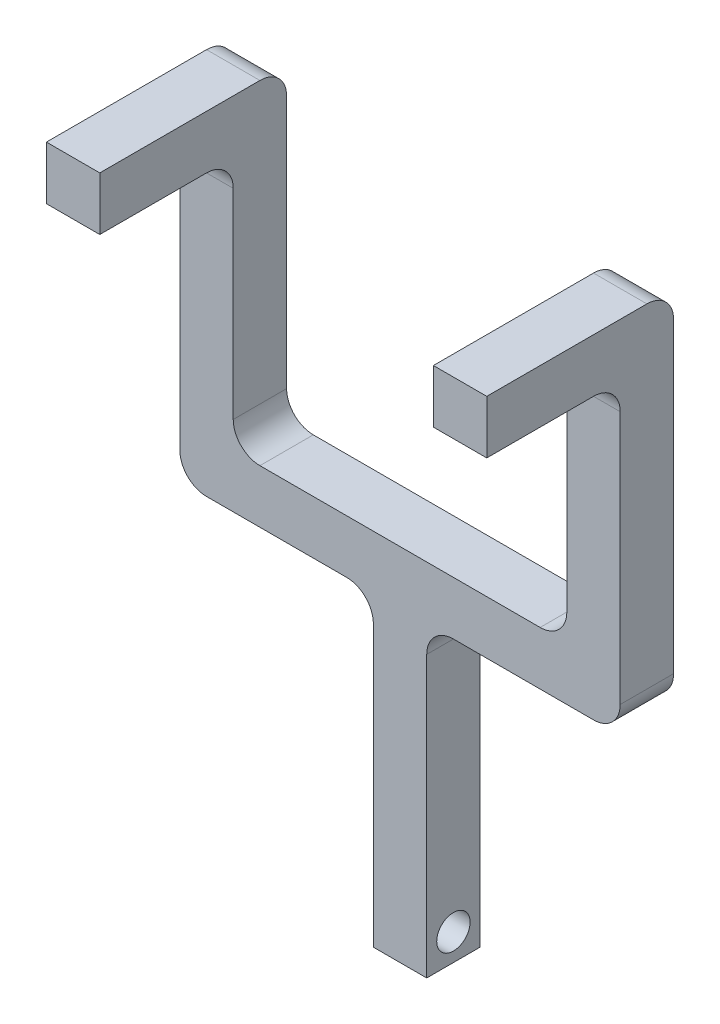
from build123d import *

# Parameters (mm, degrees)
BOSS_EXTRU_1_DEPTH                = 8
ESQUISSE2_W                       = 8
ESQUISSE2_H                       = 8
BOSS_EXTRU_2_DEPTH                = 20
DIAM_TRE_DU_PER_AGE_5_0_5_1_D     = 5
DIAM_TRE_DU_PER_AGE_5_0_5_1_DEPTH = 8
DIAM_TRE_DU_PER_AGE_5_0_5_1_TIP   = 1.502151548
CONG_1_R                          = 4


with BuildPart() as part:
    # Esquisse1 → Boss.-Extru.1 (new body)
    with BuildSketch(Plane.XY):
        Polygon((29, 0), (29, 46), (0, 46), (0, 100), (8, 100), (8, 54), (58, 54), (58, 100), (66, 100), (66, 46), (37, 46), (37, 0), align=None)
    extrude(amount=BOSS_EXTRU_1_DEPTH)

    # Esquisse2 → Boss.-Extru.2 (add)
    with BuildSketch(Plane.XY.offset(8)):
        with Locations((4, 96)):
            Rectangle(ESQUISSE2_W, ESQUISSE2_H)
        with Locations((62, 96)):
            Rectangle(ESQUISSE2_W, ESQUISSE2_H)
    extrude(amount=BOSS_EXTRU_2_DEPTH)

    # Diamètre du perçage Ø5.0 (5)1
    with Locations(Plane.ZY.offset(-29)):
        with Locations((4, 4)):
            Hole(DIAM_TRE_DU_PER_AGE_5_0_5_1_D / 2, depth=DIAM_TRE_DU_PER_AGE_5_0_5_1_DEPTH)
            with Locations((0, 0, -(DIAM_TRE_DU_PER_AGE_5_0_5_1_DEPTH + DIAM_TRE_DU_PER_AGE_5_0_5_1_TIP / 2))):  # 118° drill point
                Cone(0, DIAM_TRE_DU_PER_AGE_5_0_5_1_D / 2, DIAM_TRE_DU_PER_AGE_5_0_5_1_TIP, mode=Mode.SUBTRACT)

    # Congé1
    cong_1_edges = [part.edges().sort_by_distance(p)[0] for p in [
        (66, 46, 4),
        (37, 46, 4),
        (62, 100, 0),
        (58, 54, 4),
        (8, 54, 4),
        (4, 100, 0),
        (0, 46, 4),
        (29, 46, 4),
        (62, 92, 8),
        (4, 92, 8),
    ]]
    fillet(cong_1_edges, radius=CONG_1_R)


solid = part.part
